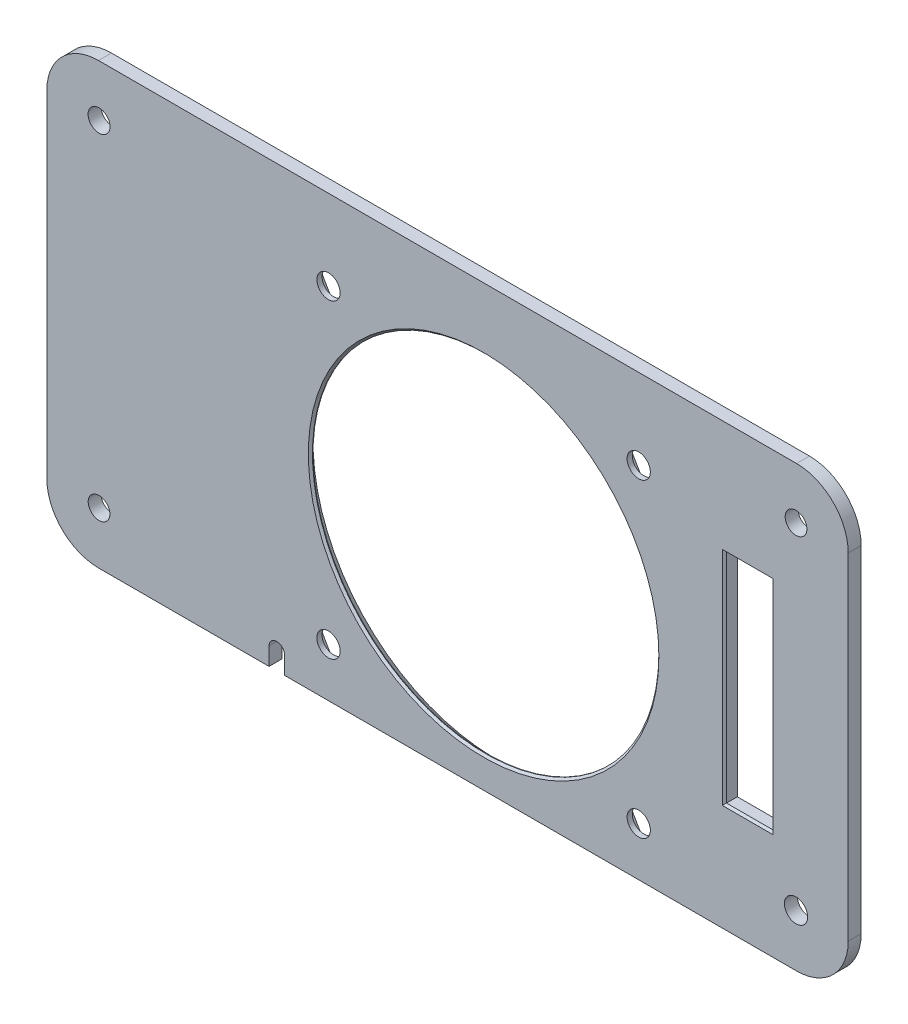
from build123d import *

# Parameters (mm, degrees)
BOSS_EXTRUDE1_DEPTH = 2.5
SKETCH3_R           = 2.25
SKETCH3_R_2         = 2.1
SKETCH3_R_3         = 2.121320344
CUT_EXTRUDE1_DEPTH  = 3
SKETCH4_R           = 33.5
SKETCH4_R_2         = 2.25
CUT_EXTRUDE2_DEPTH  = 5
CUT_EXTRUDE3_DEPTH  = 1.5
CHAMFER1_SIZE       = 2
CUT_EXTRUDE4_DEPTH  = 3
SKETCH7_R           = 2.25
SKETCH7_R_2         = 1.25
BOSS_EXTRUDE2_DEPTH = 3
CHAMFER2_SIZE       = 2
SKETCH12_W          = 9
SKETCH12_H          = 42.1
CUT_EXTRUDE5_DEPTH  = 7
CHAMFER3_SIZE       = 0.4


with BuildPart() as part:
    # Sketch1 → Boss-Extrude1 (new body)
    with BuildSketch(Plane.XY):
        with BuildLine():
            Line((-15.633211847, 85.984955899), (119.366788153, 85.984955899))
            ThreePointArc((119.366788153, 85.984955899), (126.437855965, 83.05602371), (129.366788153, 75.984955899))
            Line((129.366788153, 75.984955899), (129.366788153, 10.984955899))
            ThreePointArc((129.366788153, 10.984955899), (126.437855965, 3.913888087), (119.366788153, 0.984955899))
            Line((119.366788153, 0.984955899), (-15.633211847, 0.984955899))
            ThreePointArc((-15.633211847, 0.984955899), (-22.704279659, 3.913888087), (-25.633211847, 10.984955899))
            Line((-25.633211847, 10.984955899), (-25.633211847, 75.984955899))
            ThreePointArc((-25.633211847, 75.984955899), (-22.704279659, 83.05602371), (-15.633211847, 85.984955899))
        make_face()
    extrude(amount=BOSS_EXTRUDE1_DEPTH)

    # Sketch3 → Cut-Extrude1 (cut)
    with BuildSketch(Plane.XY.offset(2.5)):
        with Locations((119.266788153, 11.084955899)):
            Circle(SKETCH3_R)
        with Locations((119.266788153, 75.984955899)):
            Circle(SKETCH3_R_2)
        with Locations((-15.533211847, 75.984955899)):
            Circle(SKETCH3_R_3)
        with Locations((-15.533211847, 11.084955899)):
            Circle(SKETCH3_R_2)
    extrude(amount=-CUT_EXTRUDE1_DEPTH, mode=Mode.SUBTRACT)

    # Sketch4 → Cut-Extrude2 (cut)
    with BuildSketch(Plane.XY.offset(2.5)):
        with Locations((58.842502754, 40.410046739)):
            Circle(SKETCH4_R)
        with Locations((28.842502754, 70.410046739)):
            Circle(SKETCH4_R_2)
        with Locations((88.842502754, 70.410046739)):
            Circle(SKETCH4_R_2)
        with Locations((88.842502754, 10.410046739)):
            Circle(SKETCH4_R_2)
        with Locations((28.842502754, 10.410046739)):
            Circle(SKETCH4_R_2)
    extrude(amount=-CUT_EXTRUDE2_DEPTH, mode=Mode.SUBTRACT)

    # Sketch5 → Cut-Extrude3 (cut)
    with BuildSketch(Plane(origin=(0, 0, 0), x_dir=(-1, 0, 0), z_dir=(0, 0, -1))):
        Polygon((-93.172629773, 10.410046739), (-91.007566263, 6.660046739), (-86.677439244, 6.660046739), (-84.512375735, 10.410046739), (-86.677439244, 14.160046739), (-91.007566263, 14.160046739), align=None)
        Polygon((-33.172629773, 10.410046739), (-31.007566263, 6.660046739), (-26.677439244, 6.660046739), (-24.512375735, 10.410046739), (-26.677439244, 14.160046739), (-31.007566263, 14.160046739), align=None)
        Polygon((-93.172629773, 70.410046739), (-91.007566263, 66.660046739), (-86.677439244, 66.660046739), (-84.512375735, 70.410046739), (-86.677439244, 74.160046739), (-91.007566263, 74.160046739), align=None)
        Polygon((-33.172629773, 70.410046739), (-31.007566263, 66.660046739), (-26.677439244, 66.660046739), (-24.512375735, 70.410046739), (-26.677439244, 74.160046739), (-31.007566263, 74.160046739), align=None)
    extrude(amount=-CUT_EXTRUDE3_DEPTH, mode=Mode.SUBTRACT)

    # Chamfer1
    chamfer1_edges = [part.edges().sort_by_distance(p)[0] for p in [
        (25.342502754, 40.410046739, 0),
    ]]
    chamfer(chamfer1_edges, length=CHAMFER1_SIZE)

    # Sketch6 → Cut-Extrude4 (cut)
    with BuildSketch(Plane.XY.offset(2.5)):
        with BuildLine():
            Line((20.342502754, 4.410046739), (20.342502754, 0.984955899))
            ThreePointArc((20.342502754, 0.984955899), (18.842502754, -0.515044101), (17.342502754, 0.984955899))
            Line((17.342502754, 0.984955899), (17.342502754, 4.410046739))
            ThreePointArc((17.342502754, 4.410046739), (18.842502754, 5.910046739), (20.342502754, 4.410046739))
        make_face()
    extrude(amount=-CUT_EXTRUDE4_DEPTH, mode=Mode.SUBTRACT)

    # Sketch7 → Boss-Extrude2 (add)
    # profile 1 of 2: a face of its own
    with BuildSketch(Plane(origin=(0, 0, 0), x_dir=(-1, 0, 0), z_dir=(0, 0, -1))):
        with Locations((18.233971147, 25.069955899)):
            Circle(SKETCH7_R)
        with Locations((18.233971147, 25.069955899)):
            Circle(SKETCH7_R_2, mode=Mode.SUBTRACT)
    # profile 2 of 2: a face of its own
    with BuildSketch(Plane(origin=(0, 0, 0), x_dir=(-1, 0, 0), z_dir=(0, 0, -1))):
        with Locations((1.723971147, 25.069955899)):
            Circle(SKETCH7_R)
        with Locations((1.723971147, 25.069955899)):
            Circle(SKETCH7_R_2, mode=Mode.SUBTRACT)
    extrude(amount=BOSS_EXTRUDE2_DEPTH)

    # Chamfer2
    chamfer2_edges = [part.edges().sort_by_distance(p)[0] for p in [
        (0.526028853, 25.069955899, 0),
        (-15.983971147, 25.069955899, 0),
    ]]
    chamfer(chamfer2_edges, length=CHAMFER2_SIZE)

    # Sketch12 → Cut-Extrude5 (cut)
    with BuildSketch(Plane.XY.offset(2.5)):
        with Locations((109.912689541, 42.984621363)):
            Rectangle(SKETCH12_W, SKETCH12_H)
    extrude(amount=-CUT_EXTRUDE5_DEPTH, mode=Mode.SUBTRACT)

    # Chamfer3
    chamfer3_edges = [part.edges().sort_by_distance(p)[0] for p in [
        (25.342502754, 40.410046739, 2.5),
        (109.912689541, 21.934621363, 2.5),
        (114.412689541, 42.984621363, 2.5),
        (109.912689541, 64.034621363, 2.5),
        (105.412689541, 42.984621363, 2.5),
    ]]
    chamfer(chamfer3_edges, length=CHAMFER3_SIZE)


solid = part.part
